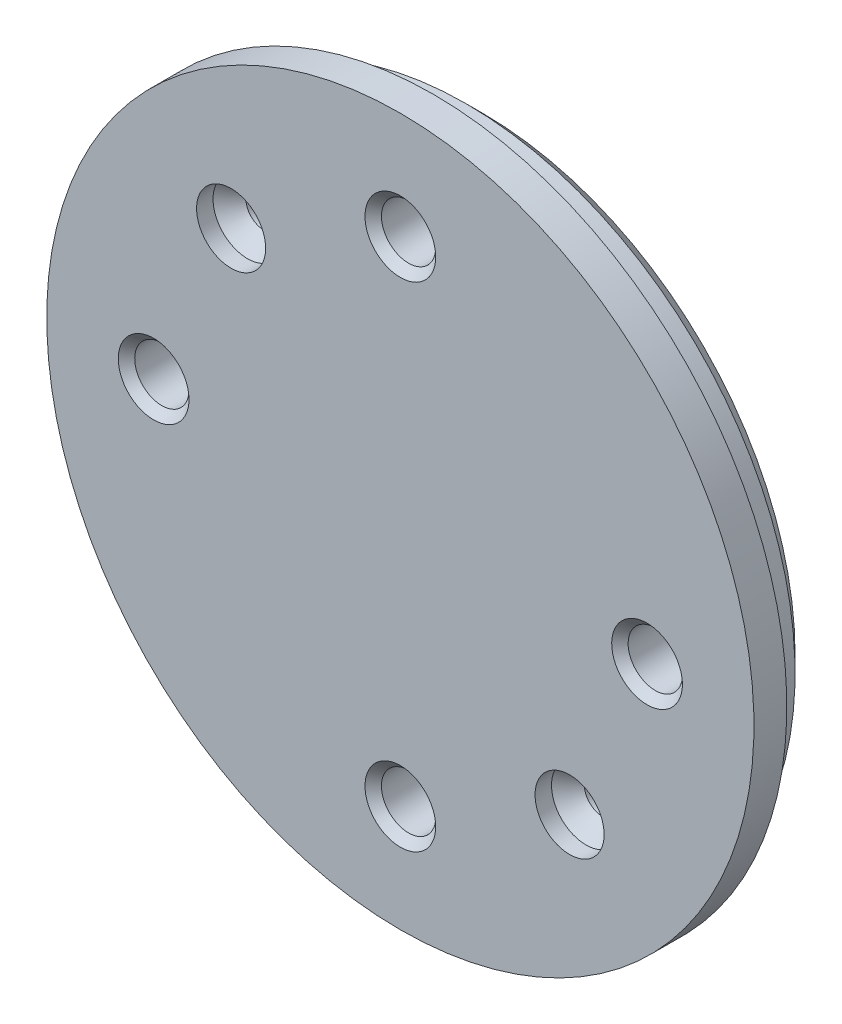
from build123d import *

# Parameters (mm, degrees)
SKETCH2_R                    = 1.6500000000000001
CUT_EXTRUDE1_DEPTH           = 10
CHAMFER1_SIZE                = 0.5
CIRPATTERN1_COUNT            = 4
CHAMFER1_OF_CIRPATTERN1_SIZE = 0.5
CUT_EXTRUDE2_DEPTH           = 2
CHAMFER2_SIZE                = 1
SKETCH4_R                    = 1.09999999999999
CUT_EXTRUDE3_DEPTH           = 31.553232234904378
CHAMFER3_SIZE                = 1


# Read off the part's stored shape, not the designer's step: CirPattern2
with BuildPart() as part:
    # Sketch1 → Revolve1 (revolve)
    with BuildSketch(Plane(origin=(0, 0, 0), x_dir=(0, 0, -1), z_dir=(1, 0, 0))):
        Polygon((0, 0), (0, 21.5), (2, 21.5), (2, 20), (4.999999999999999, 20), (5.000000000000003, -1.7e-16), align=None)
    revolve(axis=Axis((0, -1.7e-16, -5.000000000000003), (0, 3e-17, 1)))

    # Sketch2 → Cut-Extrude1 (cut)
    with BuildSketch(Plane.XY):
        with Locations((0, 15)):
            Circle(SKETCH2_R)
    cut_extrude1 = extrude(amount=-CUT_EXTRUDE1_DEPTH, mode=Mode.SUBTRACT)

    # Chamfer1
    chamfer1_edges = [part.edges().sort_by_distance(p)[0] for p in [
        (-1.6500000000000001, 15.000000000000002, 0),
    ]]
    chamfer(chamfer1_edges, length=CHAMFER1_SIZE)

    # CirPattern1: Cut-Extrude1 ×4 about axis
    cirpattern1_axis = Axis((-2.619e-14, -5e-17, 0), (0, 0, 1))
    for i in range(1, CIRPATTERN1_COUNT):
        add(cut_extrude1.rotate(cirpattern1_axis, i * 360 / CIRPATTERN1_COUNT), mode=Mode.SUBTRACT)

    # Chamfer1 of CirPattern1
    chamfer1_of_cirpattern1_edges = [part.edges().sort_by_distance(p)[0] for p in [
        (-15.000000000000028, -1.649999999999973, 0),
        (1.649999999999946, -15.000000000000002, 0),
        (14.999999999999975, 1.6499999999999713, 0),
    ]]
    chamfer(chamfer1_of_cirpattern1_edges, length=CHAMFER1_OF_CIRPATTERN1_SIZE)

    # Sketch3 → Cut-Extrude2 (cut)
    with BuildSketch(Plane.XY):
        with BuildLine():
            ThreePointArc((-11.775069570500428, 11.77506957050046), (-11.77506957050042, 8.805221089516952), (-8.805221089516914, 8.805221089516971))
            Line((-8.805221089516925, 8.805221089516953), (-11.775069570500422, 11.77506957050046))
        make_face()
        with BuildLine():
            Line((-11.775069570500422, 11.77506957050046), (-8.805221089516925, 8.805221089516953))
            ThreePointArc((-8.805221089516914, 8.805221089516971), (-8.34999831173497, 9.486510122042029), (-8.190145330008676, 10.29014533000871))
            ThreePointArc((-8.190145330008676, 10.29014533000871), (-9.486510122041988, 12.230292348282413), (-11.775069570500428, 11.77506957050046))
        make_face()
    extrude(amount=-CUT_EXTRUDE2_DEPTH, mode=Mode.SUBTRACT)

    # Chamfer2
    chamfer2_edges = [part.edges().sort_by_distance(p)[0] for p in [
        (-11.775069570500419, 11.775069570500454, -2),
    ]]
    chamfer(chamfer2_edges, length=CHAMFER2_SIZE)

    # Sketch4 → Cut-Extrude3 (cut, through all)
    with BuildSketch(Plane.XY.offset(-2)):
        with Locations((-10.290145330008677, 10.29014533000871)):
            Circle(SKETCH4_R)
    extrude(amount=-CUT_EXTRUDE3_DEPTH, mode=Mode.SUBTRACT)

    # CirPattern2 outline → CirPattern2 (revolve, cut)
    with BuildSketch(Plane(origin=(10.29014533, -10.29014533, 0), x_dir=(1, 0, 0), z_dir=(0, -1, 0))):
        Polygon((1.1, -2), (2.1, -1), (2.1, 0), (0, 0), (0, -5), (1.1, -5), align=None)
    revolve(axis=Axis((10.29014533, -10.29014533, 0), (0, 0, 1)), mode=Mode.SUBTRACT)

    # Chamfer3
    chamfer3_edges = [part.edges().sort_by_distance(p)[0] for p in [
        (-2.45e-15, -20, -4.999999999999997),
    ]]
    chamfer(chamfer3_edges, length=CHAMFER3_SIZE)


solid = part.part
